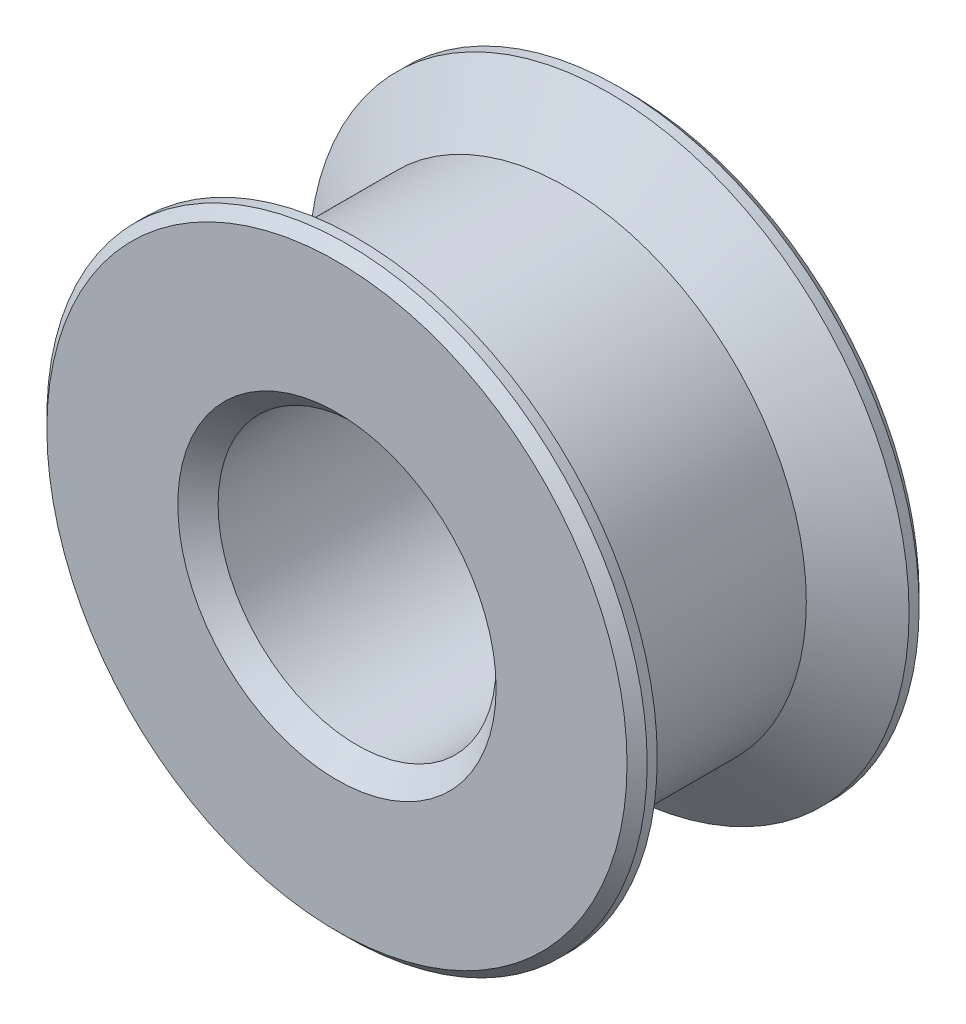
from build123d import *

# Parameters (mm, degrees)
SKETCH1_R           = 11.9
SKETCH1_R_2         = 6.9
BOSS_EXTRUDE1_DEPTH = 6.25
SKETCH2_R           = 14.9
SKETCH2_R_2         = 6.9
BOSS_EXTRUDE2_DEPTH = 1
CHAMFER1_SIZE       = 2.100622615
CHAMFER1_SIZE_2     = 3
CHAMFER2_SIZE       = 0.5
CHAMFER3_SIZE       = 1


with BuildPart() as part:
    # Sketch1 → Boss-Extrude1 (new, symmetric)
    with BuildSketch(Plane.XY):
        Circle(SKETCH1_R)
        Circle(SKETCH1_R_2, mode=Mode.SUBTRACT)
    extrude(amount=BOSS_EXTRUDE1_DEPTH, both=True)

    # Sketch2 → Boss-Extrude2 (add)
    with BuildSketch(Plane.XY.offset(6.25)):
        Circle(SKETCH2_R)
        Circle(SKETCH2_R_2, mode=Mode.SUBTRACT)
    boss_extrude2 = extrude(amount=BOSS_EXTRUDE2_DEPTH)

    # Mirror1: Boss-Extrude2 across plane
    add(boss_extrude2.mirror(Plane.XY))

    # Chamfer1
    # the kernel refuses this chamfer: 3, 2.100622615 mm, written as the material it adds along each edge
    with BuildSketch(Plane(origin=(0, 0, -6.25), x_dir=(1, 0, 0), z_dir=(0, -1, 0))) as chamfer1_piece_1_section:
        Polygon((11.9, CHAMFER1_SIZE), (11.9 + CHAMFER1_SIZE_2, 0), (11.9, 0), align=None)
    chamfer1_piece_1 = revolve(axis=Axis((0, 0, -6.25), (0, 0, 1)), mode=Mode.PRIVATE)
    chamfer1_piece_1 = chamfer1_piece_1 & Plane(origin=(0, 0, -5.219213632), x_dir=(1, 0, 0), z_dir=(0, 0, 1)) * Cylinder(14.9, 60, mode=Mode.PRIVATE)
    add(chamfer1_piece_1)
    with BuildSketch(Plane(origin=(0, 0, 6.25), x_dir=(1, 0, 0), z_dir=(0, -1, 0))) as chamfer1_piece_2_section:
        Polygon((11.9, -CHAMFER1_SIZE), (11.9 + CHAMFER1_SIZE_2, 0), (11.9, 0), align=None)
    chamfer1_piece_2 = revolve(axis=Axis((0, 0, 6.25), (0, 0, 1)), mode=Mode.PRIVATE)
    chamfer1_piece_2 = chamfer1_piece_2 & Plane(origin=(0, 0, 5.219213632), x_dir=(1, 0, 0), z_dir=(0, 0, -1)) * Cylinder(14.9, 60, mode=Mode.PRIVATE)
    add(chamfer1_piece_2)

    # Chamfer2
    chamfer2_edges = [part.edges().sort_by_distance(p)[0] for p in [
        (-14.9, 0, 7.25),
        (-14.9, 0, -7.25),
    ]]
    chamfer(chamfer2_edges, length=CHAMFER2_SIZE)

    # Chamfer3
    chamfer3_edges = [part.edges().sort_by_distance(p)[0] for p in [
        (-6.9, 0, 7.25),
        (-6.9, 0, -7.25),
    ]]
    chamfer(chamfer3_edges, length=CHAMFER3_SIZE)


solid = part.part
